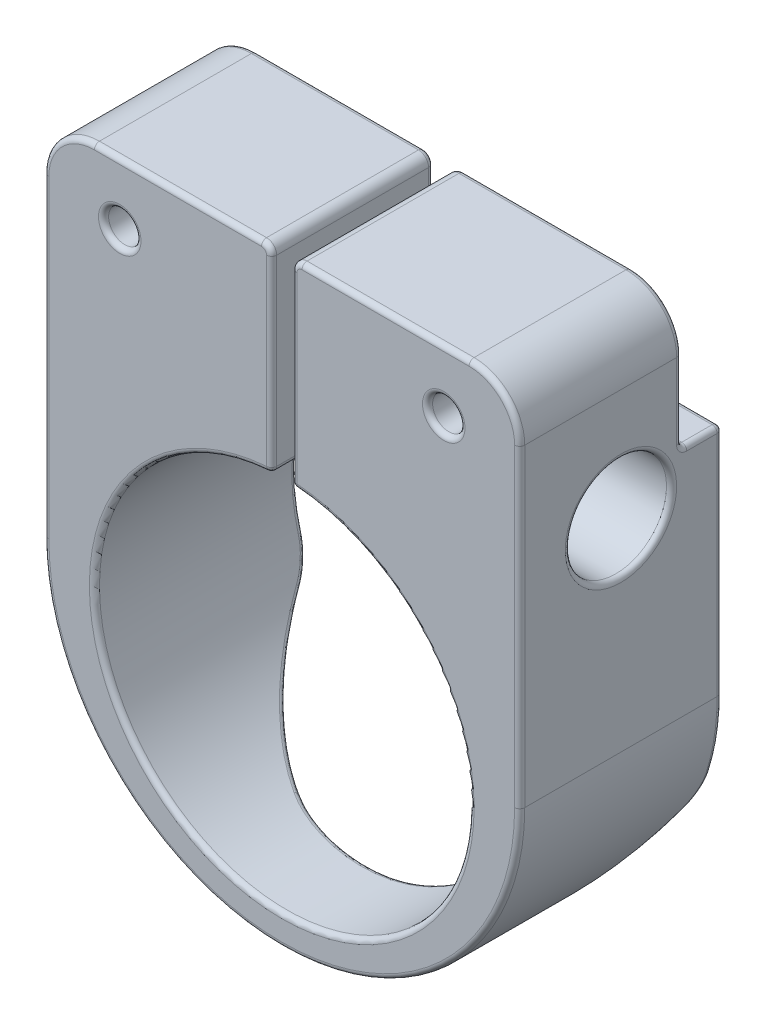
from build123d import *

# Parameters (mm, degrees)
ESQUISSE1_R                  = 18.5
BOSS_EXTRU_1_DEPTH           = 20
ESQUISSE2_W                  = 4
ESQUISSE2_H                  = 13
ENL_V_MAT_EXTRU_1_DEPTH      = 64.66317617
ENL_V_MAT_EXTRU_2_DEPTH      = 48.457876059
ENL_V_MAT_EXTRU_2_DEPTH_BACK = 48.457876059
ESQUISSE3_R                  = 1.6
ESQUISSE3_W                  = 2
ESQUISSE3_H                  = 38
ESQUISSE4_R                  = 1.6
ENL_V_MAT_EXTRU_3_DEPTH      = 64.66317617
ESQUISSE5_R                  = 5
ENL_V_MAT_EXTRU_4_DEPTH      = 12
CONG_1_R                     = 5
CONG_2_R                     = 1
CONG_3_R                     = 0.5
ENL_V_MAT_EXTRU_5_DEPTH      = 64.66317617
CONG_4_R                     = 5
CONG_5_R                     = 0.5


with BuildPart() as part:
    # Esquisse1 → Boss.-Extru.1 (new body)
    with BuildSketch(Plane.XY):
        with BuildLine():
            Line((-23.5, 38), (23.5, 38))
            Line((23.5, 38), (23.5, 2))
            ThreePointArc((23.5, 2), (0, -21.5), (-23.5, 2))
            Line((-23.5, 2), (-23.5, 38))
        make_face()
        Circle(ESQUISSE1_R, mode=Mode.SUBTRACT)
    extrude(amount=BOSS_EXTRU_1_DEPTH)

    # Esquisse2 → Enlèv. mat.-Extru.1 (cut, through all)
    with BuildSketch(Plane(origin=(23.5, 0, 0), x_dir=(0, 0, -1), z_dir=(1, 0, 0))):
        with Locations((-2, 31.5)):
            Rectangle(ESQUISSE2_W, ESQUISSE2_H)
    extrude(amount=-ENL_V_MAT_EXTRU_1_DEPTH, mode=Mode.SUBTRACT)

    # Esquisse3 → Enlèv. mat.-Extru.2 (cut, two sides: drawn at the far end of the back side and taken through both)
    with BuildSketch(Plane(origin=(0, 0, 4), x_dir=(-1, 0, 0), z_dir=(0, 0, -1)).offset(-ENL_V_MAT_EXTRU_2_DEPTH_BACK)):
        with Locations(Location((-16, 32, 0), (0, 0, 90))):
            Circle(ESQUISSE3_R)
        with Locations(Location((16, 32, 0), (0, 0, 270))):
            Circle(ESQUISSE3_R)
        with Locations((0, 19)):
            Rectangle(ESQUISSE3_W, ESQUISSE3_H)
    extrude(amount=ENL_V_MAT_EXTRU_2_DEPTH + ENL_V_MAT_EXTRU_2_DEPTH_BACK, mode=Mode.SUBTRACT)

    # Esquisse4 → Enlèv. mat.-Extru.3 (cut, through all)
    with BuildSketch(Plane.ZY.offset(23.5)):
        with Locations(Location((10, 22, 0), (0, 0, 270))):
            Circle(ESQUISSE4_R)
    extrude(amount=-ENL_V_MAT_EXTRU_3_DEPTH, mode=Mode.SUBTRACT)

    # Esquisse5 → Enlèv. mat.-Extru.4 (cut)
    with BuildSketch(Plane.ZY.offset(23.5)):
        with Locations(Location((10, 22, 0), (0, 0, 270))):
            Circle(ESQUISSE5_R)
    enl_v_mat_extru_4 = extrude(amount=-ENL_V_MAT_EXTRU_4_DEPTH, mode=Mode.SUBTRACT)

    # Symétrie1: Enlèv. mat.-Extru.4 across plane
    add(enl_v_mat_extru_4.mirror(Plane(origin=(0, 0, 0), x_dir=(0, 0, 1), z_dir=(1, 0, 0))), mode=Mode.SUBTRACT)

    # Congé1
    cong_1_edges = [part.edges().sort_by_distance(p)[0] for p in [
        (-23.5, 38, 12),
        (23.5, 38, 12),
    ]]
    fillet(cong_1_edges, radius=CONG_1_R)

    # Congé2
    cong_2_edges = [part.edges().sort_by_distance(p)[0] for p in [
        (1, 38, 12),
        (-1, 38, 12),
        (-11.5, 27, 10),
        (11.5, 27, 10),
    ]]
    fillet(cong_2_edges, radius=CONG_2_R)

    # Congé3
    cong_3_edges = [part.edges().sort_by_distance(p)[0] for p in [
        (-12.25, 25, 0),
        (-12.25, 25, 4),
        (12.25, 25, 4),
        (12.25, 25, 0),
    ]]
    fillet(cong_3_edges, radius=CONG_3_R)

    # Esquisse7 → Enlèv. mat.-Extru.5 (cut, through all)
    with BuildSketch(Plane.ZY.offset(23.5)):
        Polygon((0, -21.5), (12, -21.5), (12, -19), (0, -7), align=None)
    extrude(amount=-ENL_V_MAT_EXTRU_5_DEPTH, mode=Mode.SUBTRACT)

    # Congé4
    # the kernel refuses this fillet: 5 mm, written as the material it adds along each edge
    with BuildSketch(Plane(origin=(-15.725181085, -19, 12), x_dir=(0, 0.7071067811865489, -0.7071067811865464), z_dir=(1, 0, 0))) as cong_4_piece_1_section:
        with BuildLine():
            CenterArc((CONG_4_R * 0.414213562373, -CONG_4_R), CONG_4_R, 90, 45)
            Line((-CONG_4_R * 0.292893218813, -CONG_4_R * 0.292893218813), (0, 0))
            Line((0, 0), (CONG_4_R * 0.414213562373, 0))
        make_face()
    cong_4_piece_1 = extrude(amount=31.450362169, mode=Mode.PRIVATE)
    cong_4_piece_1 = cong_4_piece_1 & Plane(origin=(0, 2, 11.69260684), x_dir=(1, 0, 0), z_dir=(0, 0, -1)) * Cylinder(23.5, 72, mode=Mode.PRIVATE)
    cong_4_piece_1 = cong_4_piece_1 - Plane(origin=(0, 0, 11.69260684), x_dir=(1, 0, 0), z_dir=(0, 0, -1)) * Cylinder(18.5, 72, mode=Mode.PRIVATE)
    add(cong_4_piece_1)
    # the kernel refuses this fillet: 5 mm, written as the material it takes off along each edge
    with BuildSketch(Plane(origin=(-26.885962876, -7, 0), x_dir=(0, -0.7071067811865485, 0.7071067811865467), z_dir=(1, 0, 0))) as cong_4_2_piece_1:
        with BuildLine():
            CenterArc((CONG_4_R * 0.414213562373, -CONG_4_R), CONG_4_R, 90, 45)
            Line((-CONG_4_R * 0.292893218813, -CONG_4_R * 0.292893218813), (0, 0))
            Line((0, 0), (CONG_4_R * 0.414213562373, 0))
        make_face()
    extrude(amount=14.939088616, mode=Mode.SUBTRACT)
    with BuildSketch(Plane(origin=(11.94687426, -7, 0), x_dir=(0, 1, 0), z_dir=(1, 0, 0))) as cong_4_2_piece_2:
        with BuildLine():
            CenterArc((CONG_4_R * 0.414213562373, CONG_4_R), CONG_4_R, 225, 45)
            Line((-CONG_4_R * 0.292893218813, CONG_4_R * 0.292893218813), (0, 0))
            Line((0, 0), (CONG_4_R * 0.414213562373, 0))
        make_face()
    extrude(amount=14.939088616, mode=Mode.SUBTRACT)

    # Congé5
    cong_5_edges = [part.edges().sort_by_distance(p)[0] for p in [
        (15.018875523, 10.802008055, 0),
        (17.182804812, -6.855743454, 0.386173118),
        (12.397464465, -13.731455671, 6.731455671),
        (0, -18.5, 11.288310892),
        (-12.397464465, -13.731455671, 6.731455671),
        (-17.182804813, -6.855743454, 0.386173119),
        (1, 27.736476601, 20),
        (1.292893219, 37.707106781, 20),
        (10.25, 38, 20),
        (22.035533906, 36.535533906, 20),
        (23.5, 17.5, 20),
        (0, -21.5, 20),
        (-23.5, 17.5, 20),
        (-22.035533906, 36.535533906, 20),
        (-10.25, 38, 20),
        (-1.292893219, 37.707106781, 20),
        (1, 21.486476601, 0),
        (1, 24.853553391, 0.146446609),
        (1, 25, 2),
        (1, 25.146446609, 3.853553391),
        (1, 31.25, 4),
        (1.292893219, 37.707106781, 4),
        (10.25, 38, 4),
        (22.035533906, 36.535533906, 4),
        (23.5, 29.25, 4),
        (23.5, 25.146446609, 3.853553391),
        (23.5, 25, 2),
        (23.5, 24.853553391, 0.146446609),
        (23.5, 13.25, 0),
        (23.237353941, -1.503624097, 0),
        (21.770106059, -6.849433992, 0.383543251),
        (17.806447345, -13.335593662, 6.335593662),
        (-9.033479667, -19.694382802, 11.80673886),
        (9.033479667, -19.694382802, 11.80673886),
        (0, -21.5, 12),
        (-17.806447345, -13.335593662, 6.335593662),
        (-21.770106059, -6.849433992, 0.383543252),
        (-23.237353941, -1.503624097, 0),
        (-23.5, 13.25, 0),
        (-23.5, 24.853553391, 0.146446609),
        (-23.5, 25, 2),
        (-23.5, 25.146446609, 3.853553391),
        (-23.5, 29.25, 4),
        (-22.035533906, 36.535533906, 4),
        (-10.25, 38, 4),
        (-1.292893219, 37.707106781, 4),
        (-1, 31.25, 4),
        (-1, 25.146446609, 3.853553391),
        (-1, 25, 2),
        (-1, 24.853553391, 0.146446609),
        (-1, 18.472953202, 10),
        (1, 18.472953202, 10),
        (0, -18.5, 20),
        (-15.018875523, 10.802008055, 0),
        (-1, 27.736476601, 20),
        (-1, 21.486476601, 0),
        (-23.5, 27, 10),
        (23.5, 27, 10),
        (16, 30.4, 4),
        (16, 30.4, 20),
        (-16, 33.6, 4),
        (-16, 33.6, 20),
    ]]
    fillet(cong_5_edges, radius=CONG_5_R)


solid = part.part
